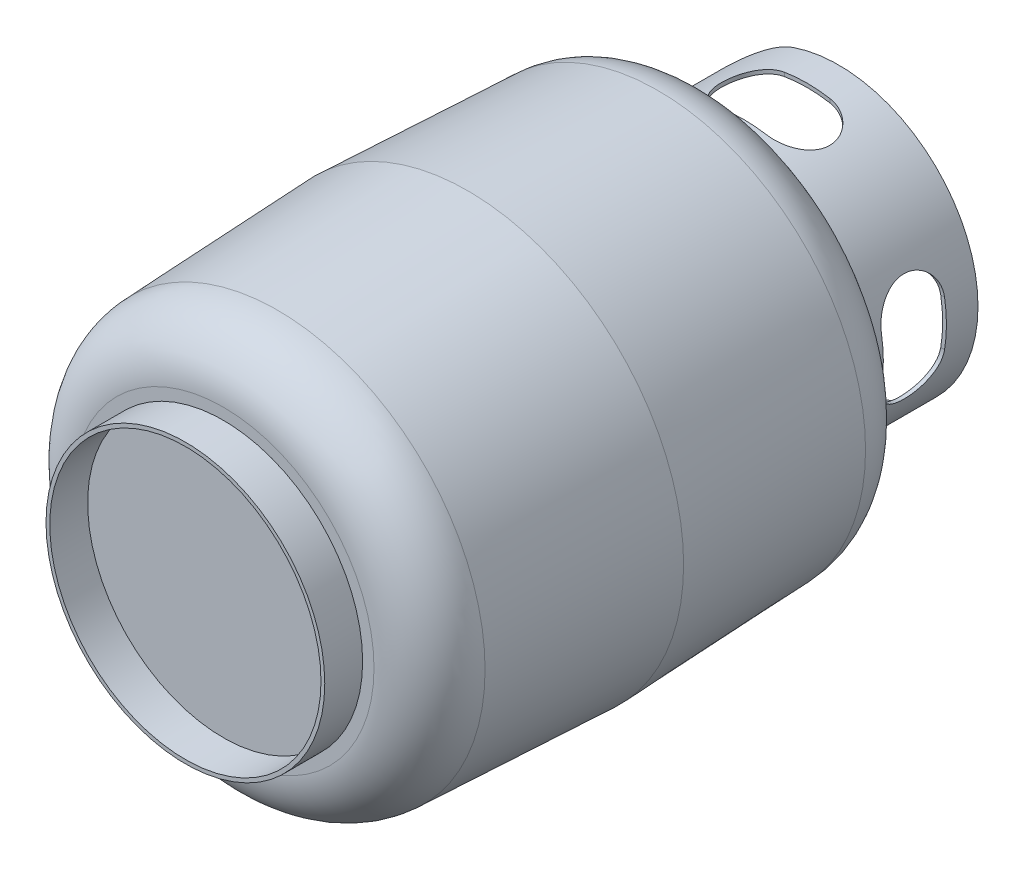
from build123d import *

# Parameters (mm, degrees)
SKETCH2_R               = 21
CUT_EXTRUDE1_DEPTH      = 4
BOSS_EXTRUDE1_DEPTH     = 100
FILLET1_R               = 30
CUT_EXTRUDE2_DEPTH      = 545.160288764
CUT_EXTRUDE2_DEPTH_BACK = 545.160288764
CUT_EXTRUDE3_DEPTH      = 545.160288764
BOSS_EXTRUDE2_START     = 30
SKETCH8_R               = 110.421871599
SKETCH8_R_2             = 107.421871599
BOSS_EXTRUDE2_DEPTH     = 30


with BuildPart() as part:
    # Sketch1 → Revolve1 (revolve)
    with BuildSketch(Plane(origin=(0, 0, 0), x_dir=(1, 0, 0), z_dir=(0, 1, 0)), mode=Mode.PRIVATE) as revolve1_sk:
        with BuildLine():
            Line((0, 0), (-119.421871599, 0))
            ThreePointArc((-119.421871599, 0), (-150.539959109, 12.493621707), (-164.37904157, 43.037127569))
            Line((-164.37904157, 43.037127569), (-170.959307689, 193.75))
            Line((-170.959307689, 193.75), (-164.37904157, 344.462872431))
            ThreePointArc((-164.37904157, 344.462872431), (-150.539959109, 375.006378293), (-119.421871599, 387.5))
            Line((-119.421871599, 387.5), (-37, 387.5))
            ThreePointArc((-37, 387.5), (-28.514718626, 391.014718626), (-25, 399.5))
            Line((-25, 399.5), (-25, 403.5))
            Line((-25, 403.5), (0, 403.5))
            Line((0, 403.5), (0, 399.5))
            Line((0, 399.5), (-21, 399.5))
            ThreePointArc((-21, 399.5), (-25.686291501, 388.186291501), (-37, 383.5))
            Line((-37, 383.5), (-119.421871599, 383.5))
            ThreePointArc((-119.421871599, 383.5), (-147.773906886, 372.116922444), (-160.382848683, 344.288394882))
            Line((-160.382848683, 344.288394882), (-166.955496948, 193.75))
            Line((-166.955496948, 193.75), (-160.382848683, 43.211605118))
            ThreePointArc((-160.382848683, 43.211605118), (-147.773906886, 15.383077556), (-119.421871599, 4))
            Line((-119.421871599, 4), (0, 4))
            Line((0, 4), (0, 0))
        make_face()
    revolve(revolve1_sk.sketch.rotate(Axis((0, 0, 0), (0, 0, -1)), 180), axis=Axis((0, 0, 0), (0, 0, -1)))

    # Sketch2 → Cut-Extrude1 (cut)
    with BuildSketch(Plane(origin=(0, 0, -403.5), x_dir=(-1, 0, 0), z_dir=(0, 0, -1))):
        Circle(SKETCH2_R)
    extrude(amount=-CUT_EXTRUDE1_DEPTH, mode=Mode.SUBTRACT)

    # Sketch3 → Boss-Extrude1 (add)
    with BuildSketch(Plane(origin=(0, 0, -387.5), x_dir=(-1, 0, 0), z_dir=(0, 0, -1))):
        with BuildLine():
            Line((61.614654298, 87.994845721), (63.335383607, 90.452301854))
            ThreePointArc((63.335383607, 90.452301854), (-110.421871599, 0), (63.335383607, -90.452301854))
            Line((63.335383607, -90.452301854), (61.614654298, -87.994845721))
            ThreePointArc((61.614654298, -87.994845721), (-107.421871599, 0), (61.614654298, 87.994845721))
        make_face()
    extrude(amount=BOSS_EXTRUDE1_DEPTH)

    # Fillet1
    # the kernel refuses this fillet: 30 mm, written as the material it takes off along each edge
    with BuildSketch(Plane(origin=(-18.596421571, 26.5584424, -487.5), x_dir=(0, 0, 1), z_dir=(-0.5735764363510427, 0.8191520442889941, 0))) as fillet1_piece_1_section:
        with BuildLine():
            CenterArc((FILLET1_R, FILLET1_R), FILLET1_R, 180, 90)
            Line((0, FILLET1_R), (-FILLET1_R * 0.02, FILLET1_R))
            Line((-FILLET1_R * 0.02, FILLET1_R), (-FILLET1_R * 0.02, -FILLET1_R * 0.02))
            Line((-FILLET1_R * 0.02, -FILLET1_R * 0.02), (FILLET1_R, -FILLET1_R * 0.02))
            Line((FILLET1_R, -FILLET1_R * 0.02), (FILLET1_R, 0))
        make_face()
    fillet1_piece_1 = extrude(amount=153, mode=Mode.PRIVATE)
    fillet1_piece_1 = fillet1_piece_1 - Plane(origin=(0, 0, -480.726953071), x_dir=(-0.5735764363510445, -0.8191520442889929, 0), z_dir=(0, 0, 1)) * Cylinder(107.421871599, 426, mode=Mode.PRIVATE)
    fillet1_piece_1 = fillet1_piece_1 & Plane(origin=(0, 0, -480.726953071), x_dir=(-0.5735764363510439, 0.8191520442889935, 0), z_dir=(0, 0, 1)) * Cylinder(110.421871599, 426, mode=Mode.PRIVATE)
    add(fillet1_piece_1, mode=Mode.SUBTRACT)
    with BuildSketch(Plane(origin=(-106.353616333, -151.888705176, -487.5), x_dir=(0, 0, 1), z_dir=(0.573576436351045, 0.8191520442889927, 0))) as fillet1_piece_2_section:
        with BuildLine():
            CenterArc((FILLET1_R, FILLET1_R), FILLET1_R, 180, 90)
            Line((0, FILLET1_R), (-FILLET1_R * 0.02, FILLET1_R))
            Line((-FILLET1_R * 0.02, FILLET1_R), (-FILLET1_R * 0.02, -FILLET1_R * 0.02))
            Line((-FILLET1_R * 0.02, -FILLET1_R * 0.02), (FILLET1_R, -FILLET1_R * 0.02))
            Line((FILLET1_R, -FILLET1_R * 0.02), (FILLET1_R, 0))
        make_face()
    fillet1_piece_2 = extrude(amount=153, mode=Mode.PRIVATE)
    fillet1_piece_2 = fillet1_piece_2 & Plane(origin=(0, 0, -480.726957465), x_dir=(-0.5735764363510439, 0.8191520442889935, 0), z_dir=(0, 0, 1)) * Cylinder(110.421871599, 426, mode=Mode.PRIVATE)
    fillet1_piece_2 = fillet1_piece_2 - Plane(origin=(0, 0, -480.726957465), x_dir=(-0.5735764363510445, -0.8191520442889929, 0), z_dir=(0, 0, 1)) * Cylinder(107.421871599, 426, mode=Mode.PRIVATE)
    add(fillet1_piece_2, mode=Mode.SUBTRACT)

    # Sketch4 → Cut-Extrude2 (cut, two sides: drawn at the far end of the back side and taken through both)
    with BuildSketch(Plane(origin=(0, 0, 0), x_dir=(1, 0, 0), z_dir=(0, 1, 0)).offset(-CUT_EXTRUDE2_DEPTH_BACK)):
        with BuildLine():
            Line((18, 412.5), (-18, 412.5))
            ThreePointArc((-18, 412.5), (-43, 437.5), (-18, 462.5))
            Line((-18, 462.5), (18, 462.5))
            ThreePointArc((18, 462.5), (43, 437.5), (18, 412.5))
        make_face()
    extrude(amount=CUT_EXTRUDE2_DEPTH + CUT_EXTRUDE2_DEPTH_BACK, mode=Mode.SUBTRACT)

    # Sketch7 → Cut-Extrude3 (cut, through all)
    with BuildSketch(Plane(origin=(0, 0, 0), x_dir=(0, 0, -1), z_dir=(1, 0, 0))):
        with BuildLine():
            Line((462.5, 18), (462.5, -18))
            ThreePointArc((462.5, -18), (437.5, -43), (412.5, -18))
            Line((412.5, -18), (412.5, 18))
            ThreePointArc((412.5, 18), (437.5, 43), (462.5, 18))
        make_face()
    extrude(amount=CUT_EXTRUDE3_DEPTH, mode=Mode.SUBTRACT)

    # Sketch8 → Boss-Extrude2 (add)
    with BuildSketch(Plane.XY.offset(BOSS_EXTRUDE2_START)):
        with Locations(Location((0, 0, 0), (0, 0, 180))):
            Circle(SKETCH8_R)
        Circle(SKETCH8_R_2, mode=Mode.SUBTRACT)
    extrude(amount=-BOSS_EXTRUDE2_DEPTH)


solid = part.part
